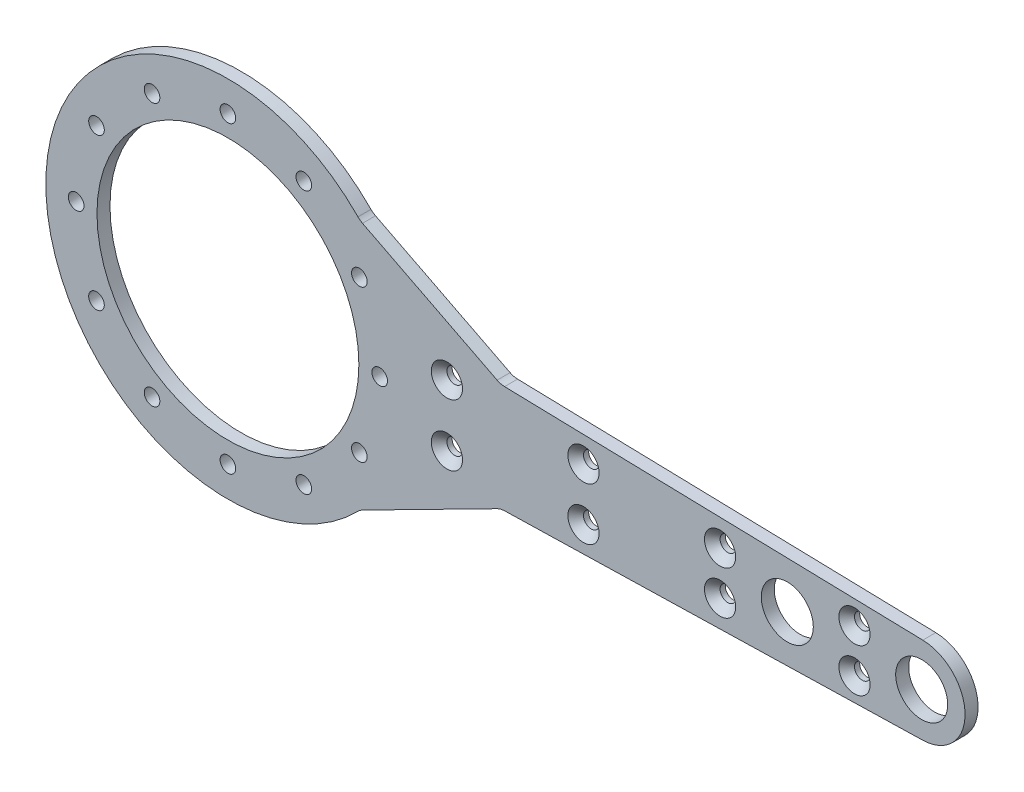
from build123d import *

# Parameters (mm, degrees)
SKETCH1_R               = 15.1
SKETCH1_R_2             = 3
BOSS_EXTRUDE1_DEPTH     = 1.5
D_GAGEMENT_M1_62_D      = 1.8
D_GAGEMENT_M1_62_DEPTH  = 11.5
CIRPATTERN1_COUNT       = 12
CHAMFER2_SIZE           = 11.480741847
FILLET4_R               = 2
D_GAGEMENT_M1_61_D      = 1.8
D_GAGEMENT_M1_61_DEPTH  = 11.5
CHAMFER3_SIZE           = 0.9
ESQUISSE1_R             = 0.9
ENL_V_MAT_EXTRU_1_DEPTH = 10
CHANFREIN1_SIZE         = 0.9
ESQUISSE2_R             = 0.9
ENL_V_MAT_EXTRU_2_DEPTH = 10
CHANFREIN2_SIZE         = 0.9


with BuildPart() as part:
    # Sketch1 → Boss-Extrude1 (new body)
    with BuildSketch(Plane.XY):
        with BuildLine():
            Line((19.968725548, 6.5), (80.124766302, 4.998443095))
            ThreePointArc((80.124766302, 4.998443095), (85, 0), (80.124766302, -4.998443095))
            Line((80.124766302, -4.998443095), (19.968725548, -6.5))
            ThreePointArc((19.968725548, -6.5), (-21, 0), (19.968725548, 6.5))
        make_face()
        Circle(SKETCH1_R, mode=Mode.SUBTRACT)
        with Locations((64.5, 0)):
            Circle(SKETCH1_R_2, mode=Mode.SUBTRACT)
        with Locations((80, 0)):
            Circle(SKETCH1_R_2, mode=Mode.SUBTRACT)
    extrude(amount=BOSS_EXTRUDE1_DEPTH)

    # Dégagement M1.62
    with Locations(Plane.XY.offset(1.5)):
        with Locations((0, 17.5)):
            d_gagement_m1_62 = Hole(D_GAGEMENT_M1_62_D / 2, depth=D_GAGEMENT_M1_62_DEPTH)

    # CirPattern1: Dégagement M1.62 ×12 about axis
    cirpattern1_axis = Axis((0, 0, 0), (0, 0, 1))
    for i in range(1, CIRPATTERN1_COUNT):
        add(d_gagement_m1_62.rotate(cirpattern1_axis, i * 360 / CIRPATTERN1_COUNT), mode=Mode.SUBTRACT)

    # Chamfer2
    # the kernel refuses this chamfer: 11.480741847, 7 mm, written as the material it adds along each edge
    with BuildSketch(Plane(origin=(19.968725548, -6.5, 0), x_dir=(-0.5119667812352321, -0.8590052473132141, 0), z_dir=(0, 0, 1))) as chamfer2_piece_1:
        with BuildLine():
            Line((9.279580073, 0), (-CHAMFER2_SIZE * 0.533242346076, CHAMFER2_SIZE * 0.845962528924))
            Line((-CHAMFER2_SIZE * 0.533242346076, CHAMFER2_SIZE * 0.845962528924), (0, 0))
            ThreePointArc((0, 0), (4.840122862, 0.518020319), (9.279580073, 0))
        make_face()
    extrude(amount=1.5)
    with BuildSketch(Plane(origin=(19.968725548, 6.5, 0), x_dir=(0.9996886189188567, -0.024953260390352783, 0), z_dir=(0, 0, 1))) as chamfer2_piece_2:
        with BuildLine():
            Line((CHAMFER2_SIZE, 0), (-4.948265049, 7.850177026))
            ThreePointArc((-4.948265049, 7.850177026), (-2.142732691, 4.370792947), (0, 0))
            Line((0, 0), (CHAMFER2_SIZE, 0))
        make_face()
    extrude(amount=1.5)

    # Fillet4
    fillet4_edges = [part.edges().sort_by_distance(p)[0] for p in [
        (31.445892509, -6.213518059, 0.75),
        (15.217888807, 14.471207976, 0.75),
        (15.217888807, -14.471207976, 0.75),
        (31.445892509, 6.213518059, 0.75),
    ]]
    fillet(fillet4_edges, radius=FILLET4_R)

    # Dégagement M1.61
    with Locations(Plane.XY.offset(1.5)):
        with Locations((56.75, 2.5), (72.25, 2.5), (72.25, -2.5), (56.75, -2.5)):
            Hole(D_GAGEMENT_M1_61_D / 2, depth=D_GAGEMENT_M1_61_DEPTH)

    # Chamfer3
    chamfer3_edges = [part.edges().sort_by_distance(p)[0] for p in [
        (57.65, -2.5, 1.5),
        (73.15, -2.5, 1.5),
        (73.15, 2.5, 1.5),
        (57.65, 2.5, 1.5),
    ]]
    chamfer(chamfer3_edges, length=CHAMFER3_SIZE)

    # Esquisse1 → Enlèv. mat.-Extru.1 (cut)
    with BuildSketch(Plane.XY.offset(1.5)):
        with Locations((25.251835753, 3.548914074)):
            Circle(ESQUISSE1_R)
        with Locations((25.251835753, -3.548914074)):
            Circle(ESQUISSE1_R)
    extrude(amount=-ENL_V_MAT_EXTRU_1_DEPTH, mode=Mode.SUBTRACT)

    # Chanfrein1
    chanfrein1_edges = [part.edges().sort_by_distance(p)[0] for p in [
        (24.351835753, 3.548914074, 1.5),
        (24.351835753, -3.548914074, 1.5),
    ]]
    chamfer(chanfrein1_edges, length=CHANFREIN1_SIZE)

    # Esquisse2 → Enlèv. mat.-Extru.2 (cut)
    with BuildSketch(Plane.XY.offset(1.5)):
        with Locations((41.000917876, 3.024457037)):
            Circle(ESQUISSE2_R)
        with Locations((41.000917876, -3.024457037)):
            Circle(ESQUISSE2_R)
    extrude(amount=-ENL_V_MAT_EXTRU_2_DEPTH, mode=Mode.SUBTRACT)

    # Chanfrein2
    chanfrein2_edges = [part.edges().sort_by_distance(p)[0] for p in [
        (40.100917876, 3.024457037, 1.5),
        (40.100917876, -3.024457037, 1.5),
    ]]
    chamfer(chanfrein2_edges, length=CHANFREIN2_SIZE)


solid = part.part
